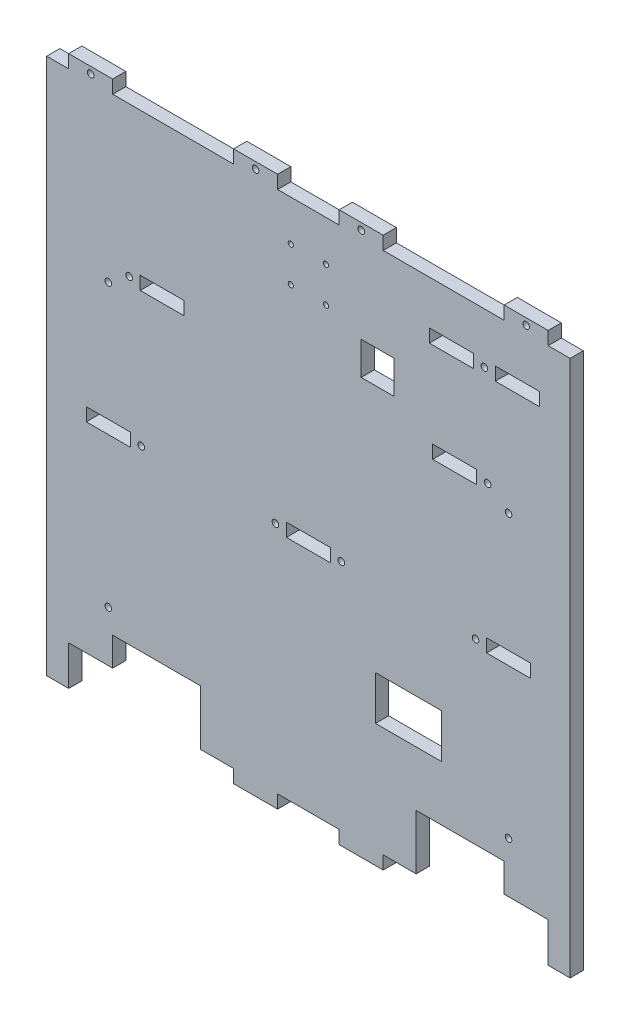
from build123d import *

# Parameters (mm, degrees)
ESQUISSE1_W             = 218
ESQUISSE1_H             = 238
ESQUISSE1_W_2           = 20
ESQUISSE1_H_2           = 6
ESQUISSE1_W_3           = 30
ESQUISSE1_H_3           = 20
ESQUISSE1_W_4           = 15
ESQUISSE1_H_4           = 15
BOSS_EXTRU_1_DEPTH      = 6
ESQUISSE2_W             = 40
ESQUISSE2_H             = 25
ENL_V_MAT_EXTRU_1_DEPTH = 6
ESQUISSE3_W             = 20
ESQUISSE3_H             = 6
BOSS_EXTRU_3_DEPTH      = 6
ESQUISSE4_R             = 1.5
ENL_V_MAT_EXTRU_2_DEPTH = 6
ESQUISSE5_W             = 10
ESQUISSE5_H             = 244
BOSS_EXTRU_4_DEPTH      = 6
ESQUISSE6_W             = 20
ESQUISSE6_H             = 12
ENL_V_MAT_EXTRU_3_DEPTH = 6
ESQUISSE7_R             = 1.175
ENL_V_MAT_EXTRU_4_DEPTH = 173.690474549


with BuildPart() as part:
    # Esquisse1 → Boss.-Extru.1 (new body)
    with BuildSketch(Plane.XY):
        Rectangle(ESQUISSE1_W, ESQUISSE1_H)
        with Locations((-91, -13)):
            Rectangle(ESQUISSE1_W_2, ESQUISSE1_H_2, mode=Mode.SUBTRACT)
        with Locations((0, -13)):
            Rectangle(ESQUISSE1_W_2, ESQUISSE1_H_2, mode=Mode.SUBTRACT)
        with Locations((91, -13)):
            Rectangle(ESQUISSE1_W_2, ESQUISSE1_H_2, mode=Mode.SUBTRACT)
        with Locations((-66.5, 51)):
            Rectangle(ESQUISSE1_W_2, ESQUISSE1_H_2, mode=Mode.SUBTRACT)
        with Locations((66.5, 51)):
            Rectangle(ESQUISSE1_W_2, ESQUISSE1_H_2, mode=Mode.SUBTRACT)
        with Locations((45.5, -59)):
            Rectangle(ESQUISSE1_W_3, ESQUISSE1_H_3, mode=Mode.SUBTRACT)
        with Locations((65, 96)):
            Rectangle(ESQUISSE1_W_2, ESQUISSE1_H_2, mode=Mode.SUBTRACT)
        with Locations((95, 96)):
            Rectangle(ESQUISSE1_W_2, ESQUISSE1_H_2, mode=Mode.SUBTRACT)
        with Locations((31.5, 71.5)):
            Rectangle(ESQUISSE1_W_4, ESQUISSE1_H_4, mode=Mode.SUBTRACT)
    extrude(amount=BOSS_EXTRU_1_DEPTH)

    # Esquisse2 → Enlèv. mat.-Extru.1 (cut)
    with BuildSketch(Plane.XY.offset(6)):
        with Locations((-69, -106.5)):
            Rectangle(ESQUISSE2_W, ESQUISSE2_H)
        with Locations((69, -106.5)):
            Rectangle(ESQUISSE2_W, ESQUISSE2_H)
    extrude(amount=-ENL_V_MAT_EXTRU_1_DEPTH, mode=Mode.SUBTRACT)

    # Esquisse3 → Boss.-Extru.3 (add)
    with BuildSketch(Plane.XY.offset(6)):
        with Locations((-24, -122)):
            Rectangle(ESQUISSE3_W, ESQUISSE3_H)
        with Locations((24, -122)):
            Rectangle(ESQUISSE3_W, ESQUISSE3_H)
        with Locations((24, 122)):
            Rectangle(ESQUISSE3_W, ESQUISSE3_H)
        with Locations((99, 122)):
            Rectangle(ESQUISSE3_W, ESQUISSE3_H)
        with Locations((-24, 122)):
            Rectangle(ESQUISSE3_W, ESQUISSE3_H)
        with Locations((-99, 122)):
            Rectangle(ESQUISSE3_W, ESQUISSE3_H)
    extrude(amount=-BOSS_EXTRU_3_DEPTH)

    # Esquisse4 → Enlèv. mat.-Extru.2 (cut)
    with BuildSketch(Plane.XY.offset(6)):
        with Locations((-15, -13)):
            Circle(ESQUISSE4_R)
        with Locations((-76, -13)):
            Circle(ESQUISSE4_R)
        with Locations((80, 96)):
            Circle(ESQUISSE4_R)
        with Locations((81.5, 51)):
            Circle(ESQUISSE4_R)
        with Locations((76, -13)):
            Circle(ESQUISSE4_R)
        with Locations((15, -13)):
            Circle(ESQUISSE4_R)
        with Locations((-81.5, 51)):
            Circle(ESQUISSE4_R)
        with Locations((-99, 122)):
            Circle(ESQUISSE4_R)
        with Locations((-24, 122)):
            Circle(ESQUISSE4_R)
        with Locations((24, 122)):
            Circle(ESQUISSE4_R)
        with Locations((99, 122)):
            Circle(ESQUISSE4_R)
        with Locations((-91, -84)):
            Circle(ESQUISSE4_R)
        with Locations((-91, 44)):
            Circle(ESQUISSE4_R)
        with Locations((91, -84)):
            Circle(ESQUISSE4_R)
        with Locations((91, 44)):
            Circle(ESQUISSE4_R)
    extrude(amount=-ENL_V_MAT_EXTRU_2_DEPTH, mode=Mode.SUBTRACT)

    # Esquisse5 → Boss.-Extru.4 (add)
    with BuildSketch(Plane.XY.offset(6)):
        with Locations((-114, -3)):
            Rectangle(ESQUISSE5_W, ESQUISSE5_H)
        with Locations((114, -3)):
            Rectangle(ESQUISSE5_W, ESQUISSE5_H)
    extrude(amount=-BOSS_EXTRU_4_DEPTH)

    # Esquisse6 → Enlèv. mat.-Extru.3 (cut)
    with BuildSketch(Plane.XY.offset(6)):
        with Locations((99, -113)):
            Rectangle(ESQUISSE6_W, ESQUISSE6_H)
        with Locations((-99, -113)):
            Rectangle(ESQUISSE6_W, ESQUISSE6_H)
    extrude(amount=-ENL_V_MAT_EXTRU_3_DEPTH, mode=Mode.SUBTRACT)

    # Esquisse7 → Enlèv. mat.-Extru.4 (cut, through all)
    with BuildSketch(Plane.XY.offset(6)):
        with Locations((-8, 100.5)):
            Circle(ESQUISSE7_R)
        with Locations((8, 100.5)):
            Circle(ESQUISSE7_R)
        with Locations((-8, 84.5)):
            Circle(ESQUISSE7_R)
        with Locations((8, 84.5)):
            Circle(ESQUISSE7_R)
    extrude(amount=-ENL_V_MAT_EXTRU_4_DEPTH, mode=Mode.SUBTRACT)


solid = part.part
